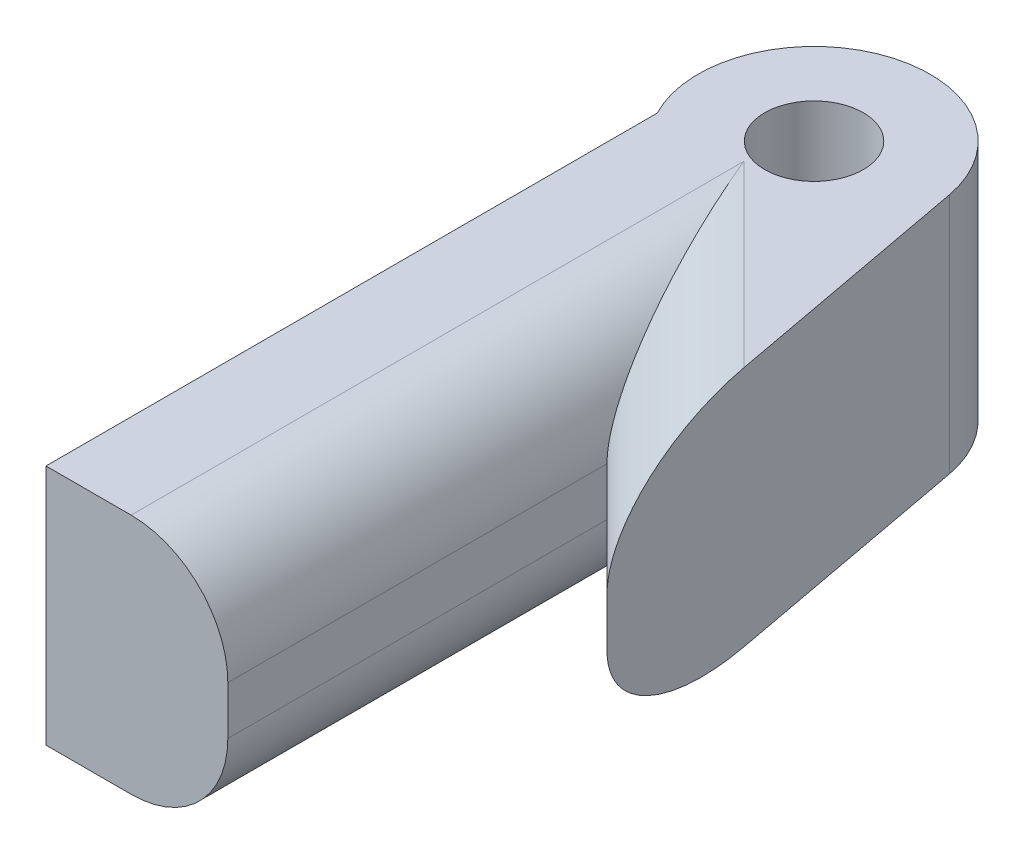
from build123d import *

# Parameters (mm, degrees)
STOCK_RATCHET_GEAR_LARGE_1_OUTLINE_R = 3.2385
STOCK_RATCHET_GEAR_LARGE_1_DEPTH     = 12.7
BOSS_EXTRUDE2_START                  = -15.875
BOSS_EXTRUDE2_DEPTH                  = 3.175
FILLET1_R                            = 6.35


# Read off the part's stored shape, not the designer's step: Stock-Ratchet Gear, Large-1
with BuildPart() as part:
    # Stock-Ratchet Gear, Large-1 outline → Stock-Ratchet Gear, Large-1 (new body)
    with BuildSketch(Plane(origin=(0, 0, 0), x_dir=(1, 0, 0), z_dir=(0, 1, 0))):
        with BuildLine():
            ThreePointArc((-23.157311364, 124.640869029), (-33.146905094, 130.445164573), (-37.393295868, 119.700398636))
            Line((-37.393295868, 119.700398636), (-37.393295868, 79.568398636))
            Line((-37.393295868, 79.568398636), (-25.455295868, 79.568398636))
            Line((-25.455295868, 79.568398636), (-25.455295868, 104.460398636))
            Line((-25.455295868, 104.460398636), (-18.015800251, 97.020903018))
            Line((-18.015800251, 97.020903018), (-23.157311364, 124.640869029))
        make_face()
        with Locations((-30.648620237, 123.246347117)):
            Circle(STOCK_RATCHET_GEAR_LARGE_1_OUTLINE_R, mode=Mode.SUBTRACT)
    extrude(amount=STOCK_RATCHET_GEAR_LARGE_1_DEPTH)

    # Sketch1 → Boss-Extrude2 (add)
    with BuildSketch(Plane(origin=(0, 12.7, 0), x_dir=(1, 0, 0), z_dir=(0, 1, 0)).offset(BOSS_EXTRUDE2_START)):
        with BuildLine():
            Line((-37.393295868, 119.700398636), (-37.393295868, 79.568398636))
            Line((-37.393295868, 79.568398636), (-25.455295868, 79.568398636))
            Line((-25.455295868, 79.568398636), (-25.455295868, 104.460398636))
            Line((-25.455295868, 104.460398636), (-18.015800251, 97.020903018))
            Line((-18.015800251, 97.020903018), (-23.157311364, 124.640869029))
            ThreePointArc((-23.157311364, 124.640869029), (-33.146905094, 130.445164573), (-37.393295868, 119.700398636))
        make_face()
    extrude(amount=BOSS_EXTRUDE2_DEPTH)

    # Fillet1
    # the kernel refuses this fillet: 6.35 mm, written as the material it takes off along each edge
    with BuildSketch(Plane(origin=(-36.68061602, -3.175, -115.685718787), x_dir=(0.7071067811865475, 0, -0.7071067811865475), z_dir=(0.7071067811865476, 0, 0.7071067811865476))) as fillet1_piece_1_section:
        with BuildLine():
            CenterArc((FILLET1_R, FILLET1_R), FILLET1_R, 180, 90)
            Line((0, FILLET1_R), (0, 0))
            Line((0, 0), (FILLET1_R, 0))
        make_face()
    fillet1_piece_1 = extrude(amount=42.2710356, mode=Mode.PRIVATE)
    fillet1_piece_1 = split(fillet1_piece_1, bisect_by=Plane(origin=(-25.455295868, -1.777167461, -96.72422015), z_dir=(1, 0, 0)), keep=Keep.TOP, mode=Mode.PRIVATE)
    add(fillet1_piece_1, mode=Mode.SUBTRACT)
    with BuildSketch(Plane(origin=(-25.455295868, -3.175, -63.693398636), x_dir=(-1, 0, 0), z_dir=(0, 0, -1))) as fillet1_piece_2_section:
        with BuildLine():
            CenterArc((FILLET1_R, FILLET1_R), FILLET1_R, 180, 90)
            Line((0, FILLET1_R), (0, 0))
            Line((0, 0), (FILLET1_R, 0))
        make_face()
    fillet1_piece_2 = extrude(amount=56.642, mode=Mode.PRIVATE)
    fillet1_piece_2 = split(fillet1_piece_2, bisect_by=Plane(origin=(-16.375055612, -1.763623306, -95.380158379), z_dir=(-0.7071067812340712, 0, 0.7071067811390238)), keep=Keep.TOP, mode=Mode.PRIVATE)
    add(fillet1_piece_2, mode=Mode.SUBTRACT)
    with BuildSketch(Plane(origin=(-36.680616019, 12.7, -115.685718788), x_dir=(0.7071067812340712, 0, -0.7071067811390238), z_dir=(0.7071067811390238, 0, 0.7071067812340712))) as fillet1_piece_3_section:
        with BuildLine():
            CenterArc((FILLET1_R, -FILLET1_R), FILLET1_R, 90, 90)
            Line((0, -FILLET1_R), (0, 0))
            Line((0, 0), (FILLET1_R, 0))
        make_face()
    fillet1_piece_3 = extrude(amount=42.271035599, mode=Mode.PRIVATE)
    fillet1_piece_3 = split(fillet1_piece_3, bisect_by=Plane(origin=(-25.455295868, 11.302167461, -96.72422015), z_dir=(1, 0, 0)), keep=Keep.TOP, mode=Mode.PRIVATE)
    add(fillet1_piece_3, mode=Mode.SUBTRACT)
    with BuildSketch(Plane(origin=(-25.455295868, 12.7, -63.693398636), x_dir=(-1, 0, 0), z_dir=(0, 0, -1))) as fillet1_piece_4_section:
        with BuildLine():
            CenterArc((FILLET1_R, -FILLET1_R), FILLET1_R, 90, 90)
            Line((0, -FILLET1_R), (0, 0))
            Line((0, 0), (FILLET1_R, 0))
        make_face()
    fillet1_piece_4 = extrude(amount=56.642, mode=Mode.PRIVATE)
    fillet1_piece_4 = split(fillet1_piece_4, bisect_by=Plane(origin=(-16.375055612, 11.288623306, -95.380158379), z_dir=(-0.7071067812340712, 0, 0.7071067811390238)), keep=Keep.TOP, mode=Mode.PRIVATE)
    add(fillet1_piece_4, mode=Mode.SUBTRACT)
    with BuildSketch(Plane(origin=(-25.455295868, -3.175, -63.693398636), x_dir=(-1, 0, 0), z_dir=(0, 0, -1))) as fillet1_piece_5a_section:
        with BuildLine():
            CenterArc((FILLET1_R, FILLET1_R), FILLET1_R, 180, 90)
            Line((0, FILLET1_R), (0, 0))
            Line((0, 0), (FILLET1_R, 0))
        make_face()
    fillet1_piece_5a = extrude(amount=56.642, mode=Mode.PRIVATE)
    fillet1_piece_5a = split(fillet1_piece_5a, bisect_by=Plane(origin=(-30.404898402, -1.660706588, -109.41000117), z_dir=(0.7071067812340712, 0, -0.7071067811390238)), keep=Keep.TOP, mode=Mode.PRIVATE)
    with BuildSketch(Plane(origin=(-36.68061602, -3.175, -115.685718787), x_dir=(0.7071067811865475, 0, -0.7071067811865475), z_dir=(0.7071067811865476, 0, 0.7071067811865476))) as fillet1_piece_5b_section:
        with BuildLine():
            CenterArc((FILLET1_R, FILLET1_R), FILLET1_R, 180, 90)
            Line((0, FILLET1_R), (0, 0))
            Line((0, 0), (FILLET1_R, 0))
        make_face()
    fillet1_piece_5b = extrude(amount=42.2710356, mode=Mode.PRIVATE)
    fillet1_piece_5b = split(fillet1_piece_5b, bisect_by=Plane(origin=(-25.455295868, -1.660706588, -111.460193667), z_dir=(-1, 0, 0)), keep=Keep.TOP, mode=Mode.PRIVATE)
    fillet1_piece_5 = fillet1_piece_5a & fillet1_piece_5b
    add(fillet1_piece_5, mode=Mode.SUBTRACT)
    with BuildSketch(Plane(origin=(-25.455295868, 12.7, -63.693398636), x_dir=(-1, 0, 0), z_dir=(0, 0, -1))) as fillet1_piece_6a_section:
        with BuildLine():
            CenterArc((FILLET1_R, -FILLET1_R), FILLET1_R, 90, 90)
            Line((0, -FILLET1_R), (0, 0))
            Line((0, 0), (FILLET1_R, 0))
        make_face()
    fillet1_piece_6a = extrude(amount=56.642, mode=Mode.PRIVATE)
    fillet1_piece_6a = split(fillet1_piece_6a, bisect_by=Plane(origin=(-30.404898402, 11.185706588, -109.41000117), z_dir=(0.7071067812340712, 0, -0.7071067811390238)), keep=Keep.TOP, mode=Mode.PRIVATE)
    with BuildSketch(Plane(origin=(-36.680616019, 12.7, -115.685718788), x_dir=(0.7071067812340712, 0, -0.7071067811390238), z_dir=(0.7071067811390238, 0, 0.7071067812340712))) as fillet1_piece_6b_section:
        with BuildLine():
            CenterArc((FILLET1_R, -FILLET1_R), FILLET1_R, 90, 90)
            Line((0, -FILLET1_R), (0, 0))
            Line((0, 0), (FILLET1_R, 0))
        make_face()
    fillet1_piece_6b = extrude(amount=42.271035599, mode=Mode.PRIVATE)
    fillet1_piece_6b = split(fillet1_piece_6b, bisect_by=Plane(origin=(-25.455295868, 11.185706588, -111.460193668), z_dir=(-1, 0, 0)), keep=Keep.TOP, mode=Mode.PRIVATE)
    fillet1_piece_6 = fillet1_piece_6a & fillet1_piece_6b
    add(fillet1_piece_6, mode=Mode.SUBTRACT)


solid = part.part
